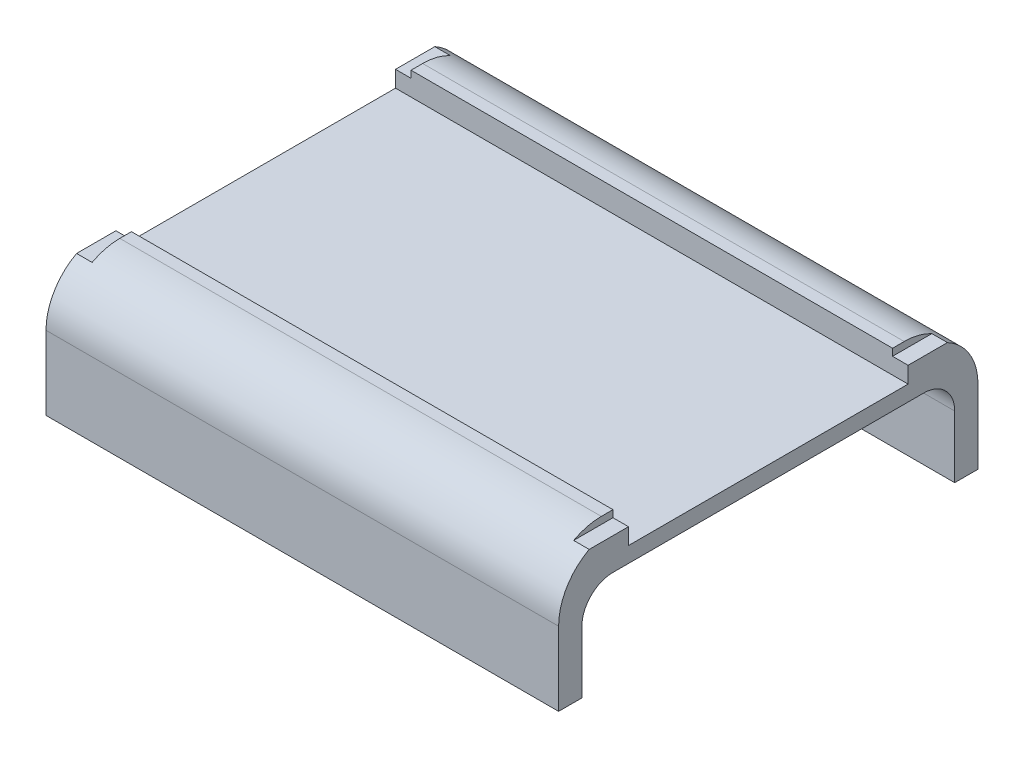
from build123d import *

# Parameters (mm, degrees)
SKETCH1_W           = 167.64
SKETCH1_H           = 137.16
BOSS_EXTRUDE1_DEPTH = 12.7
SKETCH2_W           = 167.64
SKETCH2_H           = 91.44
CUT_EXTRUDE1_DEPTH  = 7.62
SKETCH3_W           = 5.08
SKETCH3_H           = 22.86
CUT_EXTRUDE2_DEPTH  = 2.286
SKETCH4_R           = 6.35
SKETCH4_R_2         = 4.826
BOSS_EXTRUDE2_DEPTH = 30.464799878
SKETCH5_W           = 167.64
SKETCH5_H           = 7.62
BOSS_EXTRUDE3_DEPTH = 30.464799878
FILLET1_R           = 19.05
FILLET2_R           = 10.16


with BuildPart() as part:
    # Sketch1 → Boss-Extrude1 (new body)
    with BuildSketch(Plane(origin=(0, 0, 0), x_dir=(1, 0, 0), z_dir=(0, 1, 0))):
        with Locations((83.82, 68.58)):
            Rectangle(SKETCH1_W, SKETCH1_H)
    extrude(amount=BOSS_EXTRUDE1_DEPTH)

    # Sketch2 → Cut-Extrude1 (cut)
    with BuildSketch(Plane(origin=(0, 12.7, 0), x_dir=(1, 0, 0), z_dir=(0, 1, 0))):
        with Locations((83.82, 68.58)):
            Rectangle(SKETCH2_W, SKETCH2_H)
    extrude(amount=-CUT_EXTRUDE1_DEPTH, mode=Mode.SUBTRACT)

    # Sketch3 → Cut-Extrude2 (cut)
    with BuildSketch(Plane(origin=(0, 12.7, 0), x_dir=(1, 0, 0), z_dir=(0, 1, 0))):
        with Locations((2.54, 125.73)):
            Rectangle(SKETCH3_W, SKETCH3_H)
        with Locations((165.1, 125.73)):
            Rectangle(SKETCH3_W, SKETCH3_H)
        with Locations((165.1, 11.43)):
            Rectangle(SKETCH3_W, SKETCH3_H)
        with Locations((2.54, 11.43)):
            Rectangle(SKETCH3_W, SKETCH3_H)
    extrude(amount=-CUT_EXTRUDE2_DEPTH, mode=Mode.SUBTRACT)

    # Sketch4 → Boss-Extrude2 (add)
    # profile 1 of 2: a face of its own
    with BuildSketch(Plane.XZ):
        with Locations(Location((81.788, -15.494, 0), (0, 0, 90))):
            Circle(SKETCH4_R)
        with Locations(Location((81.788, -15.494, 0), (0, 0, 90))):
            Circle(SKETCH4_R_2, mode=Mode.SUBTRACT)
    # profile 2 of 2: a face of its own
    with BuildSketch(Plane.XZ):
        with Locations(Location((81.788, -121.92, 0), (0, 0, 90))):
            Circle(SKETCH4_R)
        with Locations(Location((81.788, -121.92, 0), (0, 0, 90))):
            Circle(SKETCH4_R_2, mode=Mode.SUBTRACT)
    extrude(amount=BOSS_EXTRUDE2_DEPTH)

    # Sketch5 → Boss-Extrude3 (add)
    with BuildSketch(Plane.XZ):
        with Locations((83.82, -133.35)):
            Rectangle(SKETCH5_W, SKETCH5_H)
        with Locations((83.82, -3.81)):
            Rectangle(SKETCH5_W, SKETCH5_H)
    extrude(amount=BOSS_EXTRUDE3_DEPTH)

    # Fillet1
    fillet1_edges = [part.edges().sort_by_distance(p)[0] for p in [
        (83.82, 12.7, 0),
        (83.82, 12.7, -137.16),
    ]]
    fillet(fillet1_edges, radius=FILLET1_R)

    # Fillet2
    # the kernel refuses this fillet: 10.16 mm, written as the material it adds along each edge
    with BuildSketch(Plane(origin=(0, 0, -7.62), x_dir=(0, -1, 0), z_dir=(1, 0, 0))) as fillet2_piece_1_section:
        with BuildLine():
            CenterArc((FILLET2_R, FILLET2_R), FILLET2_R, 180, 90)
            Line((0, FILLET2_R), (0, 0))
            Line((0, 0), (FILLET2_R, 0))
        make_face()
    fillet2_piece_1 = extrude(amount=167.64, mode=Mode.PRIVATE)
    fillet2_piece_1 = fillet2_piece_1 - Plane(origin=(81.788, -7.490679749, -15.494), x_dir=(0, 0, 1), z_dir=(0, 1, 0)) * Cylinder(4.826, 376, mode=Mode.PRIVATE)
    add(fillet2_piece_1)
    with BuildSketch(Plane(origin=(0, 0, -129.54), x_dir=(0, 0, 1), z_dir=(1, 0, 0))) as fillet2_piece_2_section:
        with BuildLine():
            CenterArc((FILLET2_R, FILLET2_R), FILLET2_R, 180, 90)
            Line((0, FILLET2_R), (0, 0))
            Line((0, 0), (FILLET2_R, 0))
        make_face()
    fillet2_piece_2 = extrude(amount=167.64, mode=Mode.PRIVATE)
    fillet2_piece_2 = fillet2_piece_2 - Plane(origin=(81.788, -0.198114481, -121.92), x_dir=(0, 0, 1), z_dir=(0, 1, 0)) * Cylinder(4.826, 376, mode=Mode.PRIVATE)
    add(fillet2_piece_2)


solid = part.part
